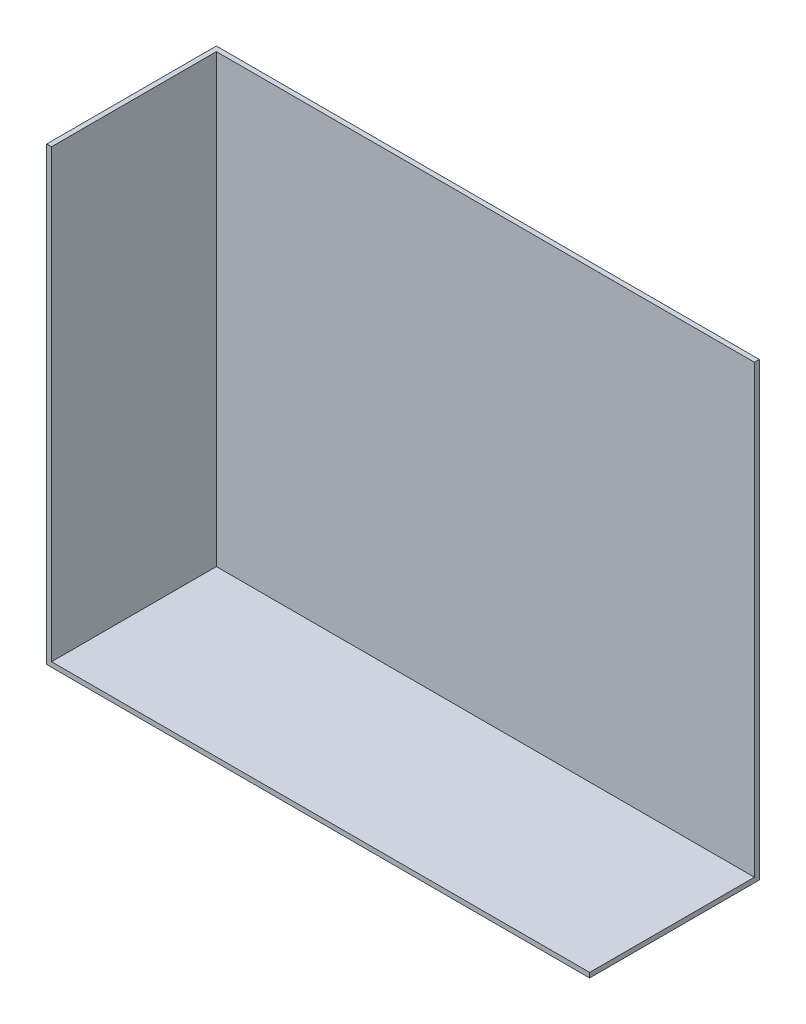
from build123d import *

# Parameters (mm, degrees)
SKETCH1_W           = 2844.8
SKETCH1_H           = 889
BOSS_EXTRUDE1_DEPTH = 2362.2
SHELL1_T            = -25.4


with BuildPart() as part:
    # Sketch1 → Boss-Extrude1 (new body)
    with BuildSketch(Plane(origin=(0, 0, 0), x_dir=(1, 0, 0), z_dir=(0, 1, 0))):
        Rectangle(SKETCH1_W, SKETCH1_H)
    extrude(amount=BOSS_EXTRUDE1_DEPTH)

    # Shell1
    shell1_openings = [part.faces().sort_by_distance(p)[0] for p in [
        (0, 2362.2, 0),
        (0, 1181.1, 444.5),
        (1422.4, 1181.1, 0),
    ]]
    offset(amount=SHELL1_T, openings=shell1_openings, kind=Kind.INTERSECTION)


solid = part.part
